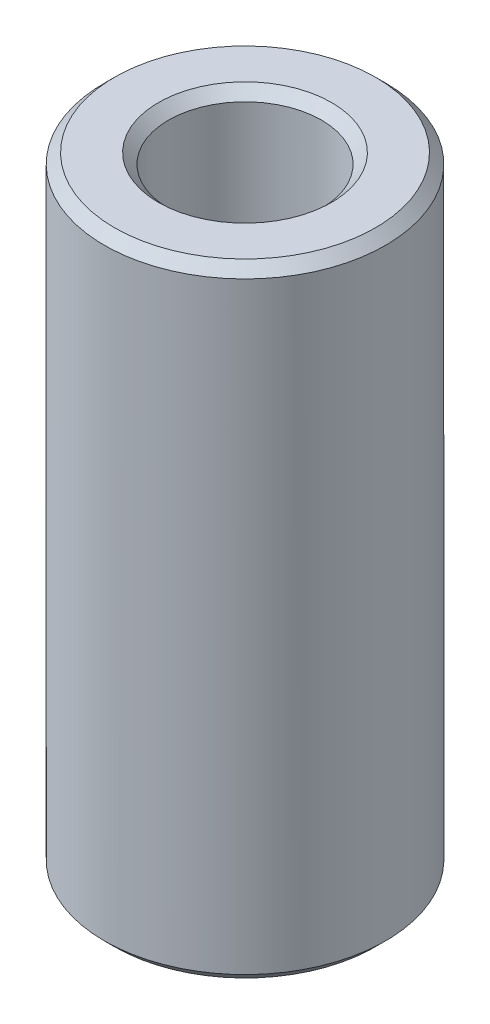
from build123d import *

# Parameters (mm, degrees)
SKETCH1_R           = 50
BOSS_EXTRUDE1_DEPTH = 221.459907417
SKETCH2_R           = 27.18721444
CUT_EXTRUDE1_DEPTH  = 233.474709578
CHAMFER1_SIZE       = 3.603240626


with BuildPart() as part:
    # Sketch1 → Boss-Extrude1 (new body)
    with BuildSketch(Plane(origin=(0, 0, 0), x_dir=(1, 0, 0), z_dir=(0, 1, 0))):
        Circle(SKETCH1_R)
    extrude(amount=BOSS_EXTRUDE1_DEPTH)

    # Sketch2 → Cut-Extrude1 (cut, through all)
    with BuildSketch(Plane(origin=(0, 0, 0), x_dir=(1, 0, 0), z_dir=(0, 1, 0))):
        Circle(SKETCH2_R)
    extrude(amount=CUT_EXTRUDE1_DEPTH, mode=Mode.SUBTRACT)

    # Chamfer1
    chamfer1_edges = [part.edges().sort_by_distance(p)[0] for p in [
        (-27.18721444, 221.459907417, 0),
        (-27.18721444, 0, 0),
        (-50, 0, 0),
        (-50, 221.459907417, 0),
    ]]
    chamfer(chamfer1_edges, length=CHAMFER1_SIZE)


solid = part.part
